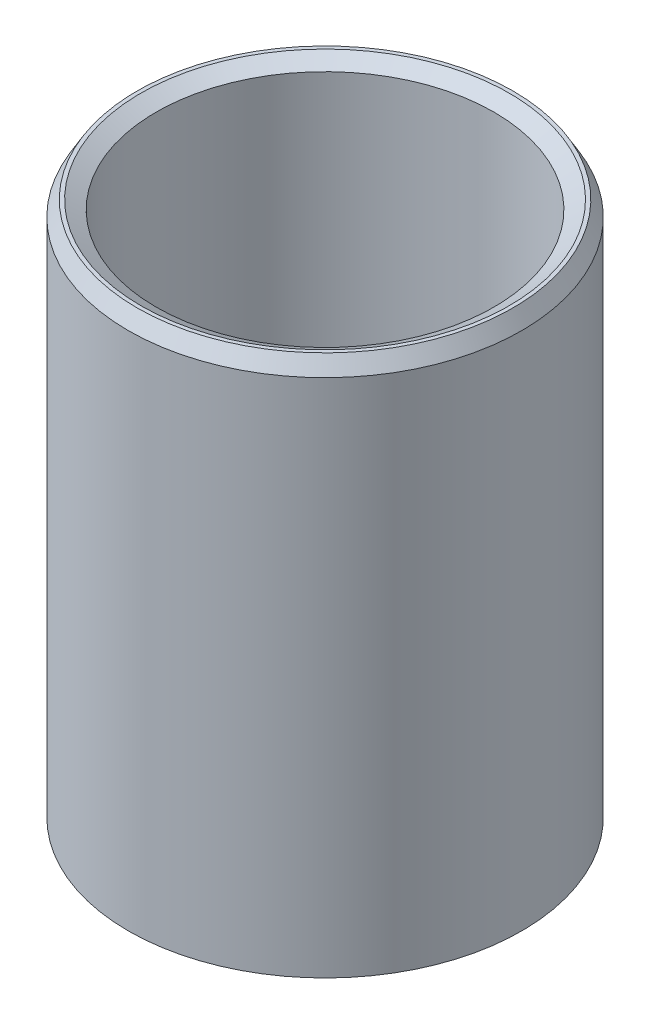
from build123d import *
from OCP.BRepFilletAPI import BRepFilletAPI_MakeChamfer

# Parameters (mm, degrees)
SKETCH1_R           = 47.5
BOSS_EXTRUDE1_DEPTH = 131.322968088
SKETCH2_R           = 40.782232067
CUT_EXTRUDE1_DEPTH  = 148.506684416
CHAMFER1_SIZE       = 3.68287462
CHAMFER1_SIZE2      = 2.126308653


with BuildPart() as part:
    # Sketch1 → Boss-Extrude1 (new body)
    with BuildSketch(Plane(origin=(0, 0, 0), x_dir=(1, 0, 0), z_dir=(0, 1, 0))):
        Circle(SKETCH1_R)
    extrude(amount=BOSS_EXTRUDE1_DEPTH)

    # Sketch2 → Cut-Extrude1 (cut, through all)
    with BuildSketch(Plane(origin=(0, 0, 0), x_dir=(1, 0, 0), z_dir=(0, 1, 0))):
        Circle(SKETCH2_R)
    extrude(amount=CUT_EXTRUDE1_DEPTH, mode=Mode.SUBTRACT)

    # Chamfer1: one chamfer whose edges measure the first distance from different faces: ONE call of the kernel's chamfer builder (chamfer() names one face for all edges)
    chamfer1_edges_1 = [part.edges().sort_by_distance(p)[0] for p in [
        (-40.782232067, 131.322968088, 0),
    ]]
    chamfer1_side_1 = [part.faces().sort_by_distance(p)[0] for p in [
        (-46.156497116, 131.322968088, 0),
    ]]
    chamfer1_edges_2 = [part.edges().sort_by_distance(p)[0] for p in [
        (-40.782232067, 0, 0),
    ]]
    chamfer1_side_2 = [part.faces().sort_by_distance(p)[0] for p in [
        (-40.782232067, 65.661484044, 0),
    ]]
    chamfer1_edges_3 = [part.edges().sort_by_distance(p)[0] for p in [
        (-47.5, 0, 0),
    ]]
    chamfer1_side_3 = [part.faces().sort_by_distance(p)[0] for p in [
        (-46.156497116, 0, 0),
    ]]
    chamfer1_edges_4 = [part.edges().sort_by_distance(p)[0] for p in [
        (-47.5, 131.322968088, 0),
    ]]
    chamfer1_side_4 = [part.faces().sort_by_distance(p)[0] for p in [
        (-47.5, 65.661484044, 0),
    ]]
    chamfer1 = BRepFilletAPI_MakeChamfer(part.part.solid().wrapped)
    for e in chamfer1_edges_1:
        chamfer1.Add(CHAMFER1_SIZE, CHAMFER1_SIZE2, e.wrapped, chamfer1_side_1[0].wrapped)  # the first distance lies on this face
    for e in chamfer1_edges_2:
        chamfer1.Add(CHAMFER1_SIZE, CHAMFER1_SIZE2, e.wrapped, chamfer1_side_2[0].wrapped)  # the first distance lies on this face
    for e in chamfer1_edges_3:
        chamfer1.Add(CHAMFER1_SIZE, CHAMFER1_SIZE2, e.wrapped, chamfer1_side_3[0].wrapped)  # the first distance lies on this face
    for e in chamfer1_edges_4:
        chamfer1.Add(CHAMFER1_SIZE, CHAMFER1_SIZE2, e.wrapped, chamfer1_side_4[0].wrapped)  # the first distance lies on this face
    add(Compound.cast(chamfer1.Shape()), mode=Mode.REPLACE)


solid = part.part
